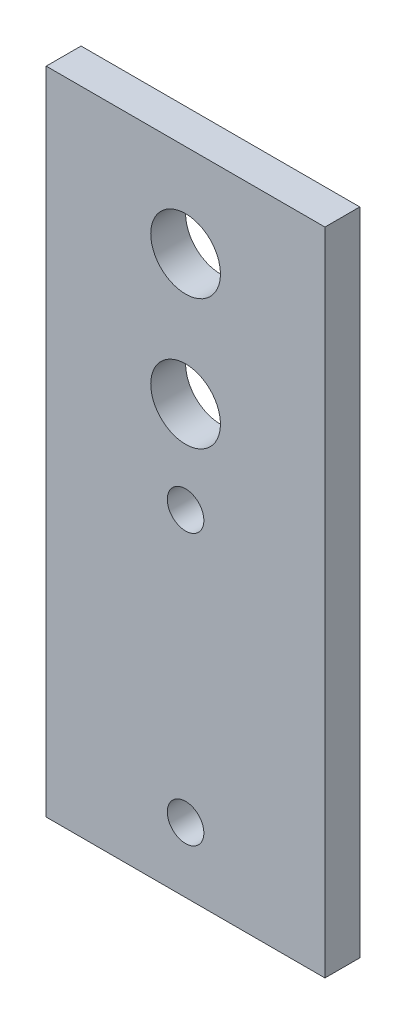
from build123d import *

# Parameters (mm, degrees)
SKETCH1_W           = 38.1
SKETCH1_H           = 88.9
SKETCH1_R           = 2.5
SKETCH1_R_2         = 4.7625
BOSS_EXTRUDE1_DEPTH = 4.7625


with BuildPart() as part:
    # Sketch1 → Boss-Extrude1 (new body)
    with BuildSketch(Plane.XY):
        with Locations((19.05, 44.45)):
            Rectangle(SKETCH1_W, SKETCH1_H)
        with Locations((19.05, 8.89)):
            Circle(SKETCH1_R, mode=Mode.SUBTRACT)
        with Locations((19.05, 45.89)):
            Circle(SKETCH1_R, mode=Mode.SUBTRACT)
        with Locations((19.05, 76.2)):
            Circle(SKETCH1_R_2, mode=Mode.SUBTRACT)
        with Locations((19.05, 58.42)):
            Circle(SKETCH1_R_2, mode=Mode.SUBTRACT)
    extrude(amount=BOSS_EXTRUDE1_DEPTH)


solid = part.part
